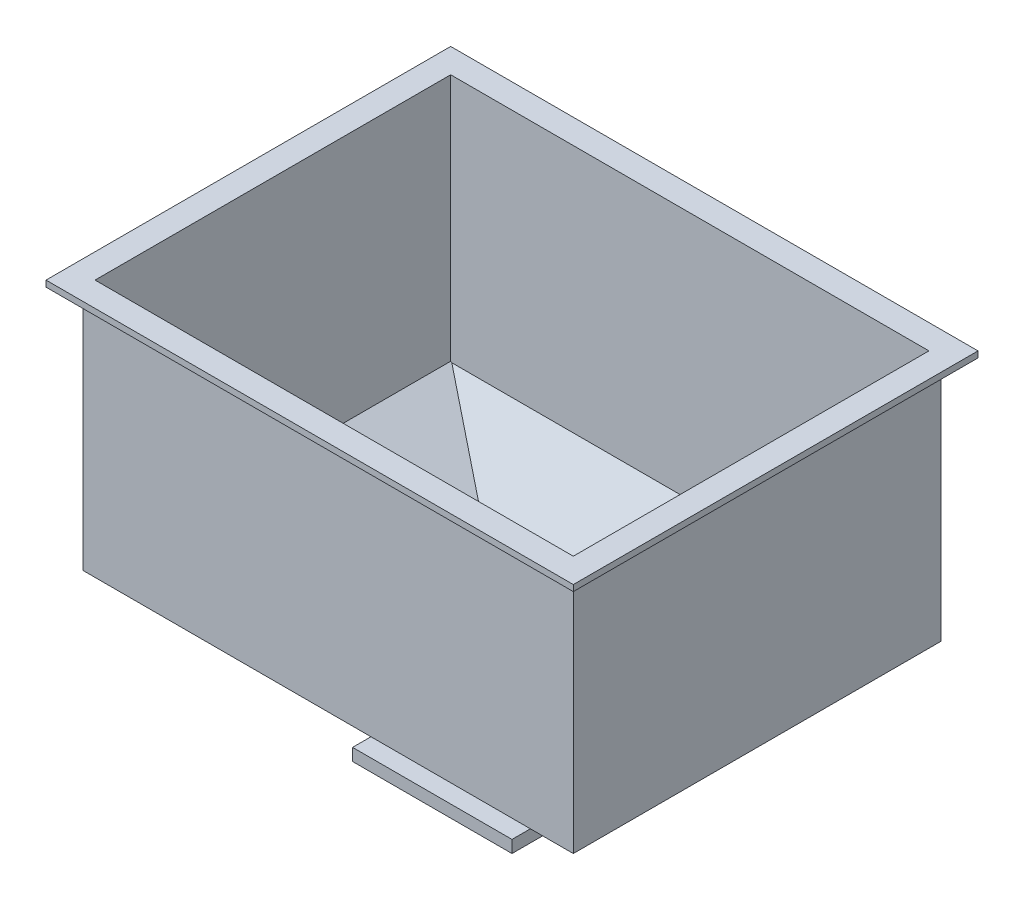
from build123d import *

# Parameters (mm, degrees)
SKETCH1_W               = 400
SKETCH1_H               = 200
BOSS_EXTRUDE1_DEPTH     = 300
CUT_EXTRUDE1_DEPTH      = 413.310562562
CUT_EXTRUDE1_DEPTH_BACK = 413.310562562
SHELL1_T                = -5
SKETCH3_W               = 430
SKETCH3_H               = 330
BOSS_EXTRUDE2_DEPTH     = 5
SHELL2_START            = 100
SHELL2_OUTLINE_W        = 390
SHELL2_OUTLINE_H        = 290
SHELL2_DEPTH            = 5
SKETCH5_W               = 130
SKETCH5_H               = 130
BOSS_EXTRUDE3_DEPTH     = 10


# Read off the part's stored shape, not the designer's step: Shell2
with BuildPart() as part:
    # Sketch1 → Boss-Extrude1 (new body)
    with BuildSketch(Plane.XY):
        Rectangle(SKETCH1_W, SKETCH1_H)
        Polygon((-50, -200), (50, -200), (200, -100), (-200, -100), align=None)
    extrude(amount=-BOSS_EXTRUDE1_DEPTH)

    # Sketch2 → Cut-Extrude1 (cut, two sides: drawn at the far end of the back side and taken through both)
    with BuildSketch(Plane(origin=(0, 0, 0), x_dir=(0, 0, -1), z_dir=(1, 0, 0)).offset(-CUT_EXTRUDE1_DEPTH_BACK)):
        Polygon((0, -100), (100, -200), (0, -200), align=None)
        Polygon((300, -100), (300, -200), (200, -200), align=None)
    extrude(amount=CUT_EXTRUDE1_DEPTH + CUT_EXTRUDE1_DEPTH_BACK, mode=Mode.SUBTRACT)

    # Shell1
    shell1_openings = [part.faces().sort_by_distance(p)[0] for p in [
        (0, -200, -150),
        (0, 100, -150),
    ]]
    offset(amount=SHELL1_T, openings=shell1_openings, kind=Kind.INTERSECTION)

    # Sketch3 → Boss-Extrude2 (add)
    with BuildSketch(Plane(origin=(0, 100, 0), x_dir=(1, 0, 0), z_dir=(0, 1, 0))):
        with Locations((0, 150)):
            Rectangle(SKETCH3_W, SKETCH3_H)
    extrude(amount=BOSS_EXTRUDE2_DEPTH)

    # Shell2 outline → Shell2 (cut)
    with BuildSketch(Plane(origin=(0, 0, 0), x_dir=(1, 0, 0), z_dir=(0, 1, 0)).offset(SHELL2_START)):
        with Locations((0, 150)):
            Rectangle(SHELL2_OUTLINE_W, SHELL2_OUTLINE_H)
    extrude(amount=SHELL2_DEPTH, mode=Mode.SUBTRACT)

    # Sketch5 → Boss-Extrude3 (add)
    with BuildSketch(Plane.XZ.offset(200)):
        with Locations((0, -150)):
            Rectangle(SKETCH5_W, SKETCH5_H)
    extrude(amount=BOSS_EXTRUDE3_DEPTH)


solid = part.part
